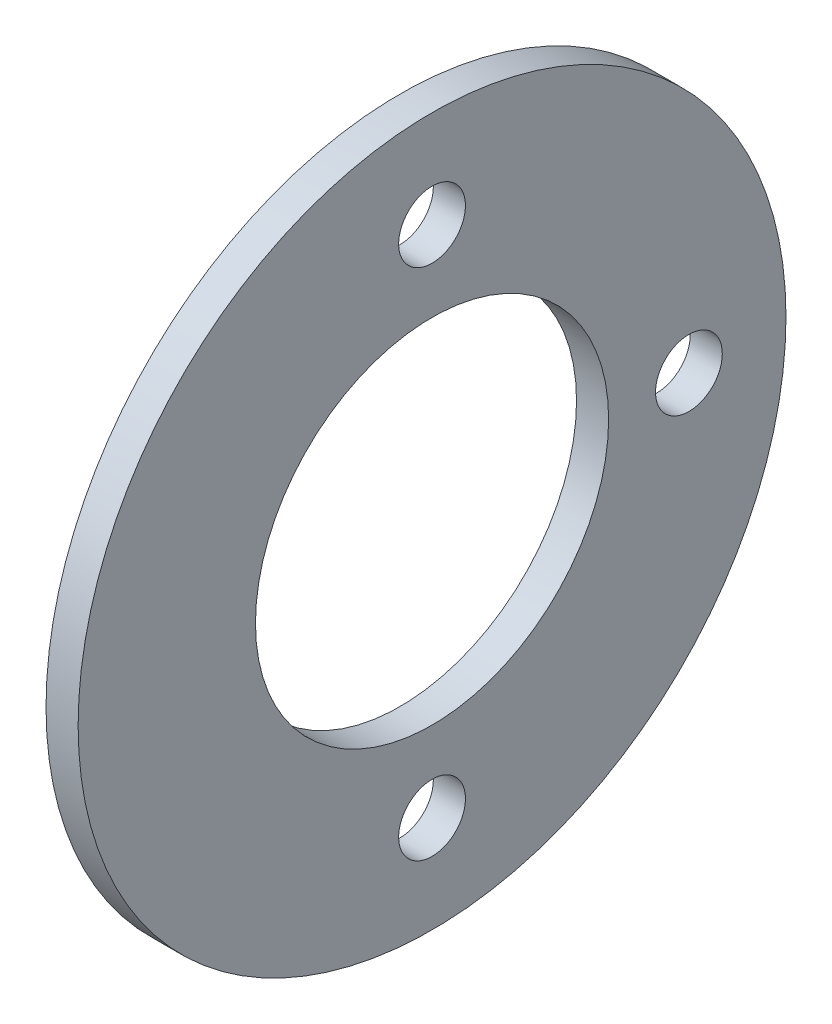
from build123d import *

# Parameters (mm, degrees)
SKETCH1_R           = 35
SKETCH1_R_2         = 17.4625
SKETCH1_R_3         = 3.302
BOSS_EXTRUDE1_DEPTH = 3.175


with BuildPart() as part:
    # Sketch1 → Boss-Extrude1 (new body)
    with BuildSketch(Plane(origin=(0, 0, 0), x_dir=(0, 0, -1), z_dir=(1, 0, 0))):
        Circle(SKETCH1_R)
        Circle(SKETCH1_R_2, mode=Mode.SUBTRACT)
        with Locations((0, 25.4)):
            Circle(SKETCH1_R_3, mode=Mode.SUBTRACT)
        with Locations((25.4, 0)):
            Circle(SKETCH1_R_3, mode=Mode.SUBTRACT)
        with Locations((0, -25.4)):
            Circle(SKETCH1_R_3, mode=Mode.SUBTRACT)
    extrude(amount=BOSS_EXTRUDE1_DEPTH)


solid = part.part
